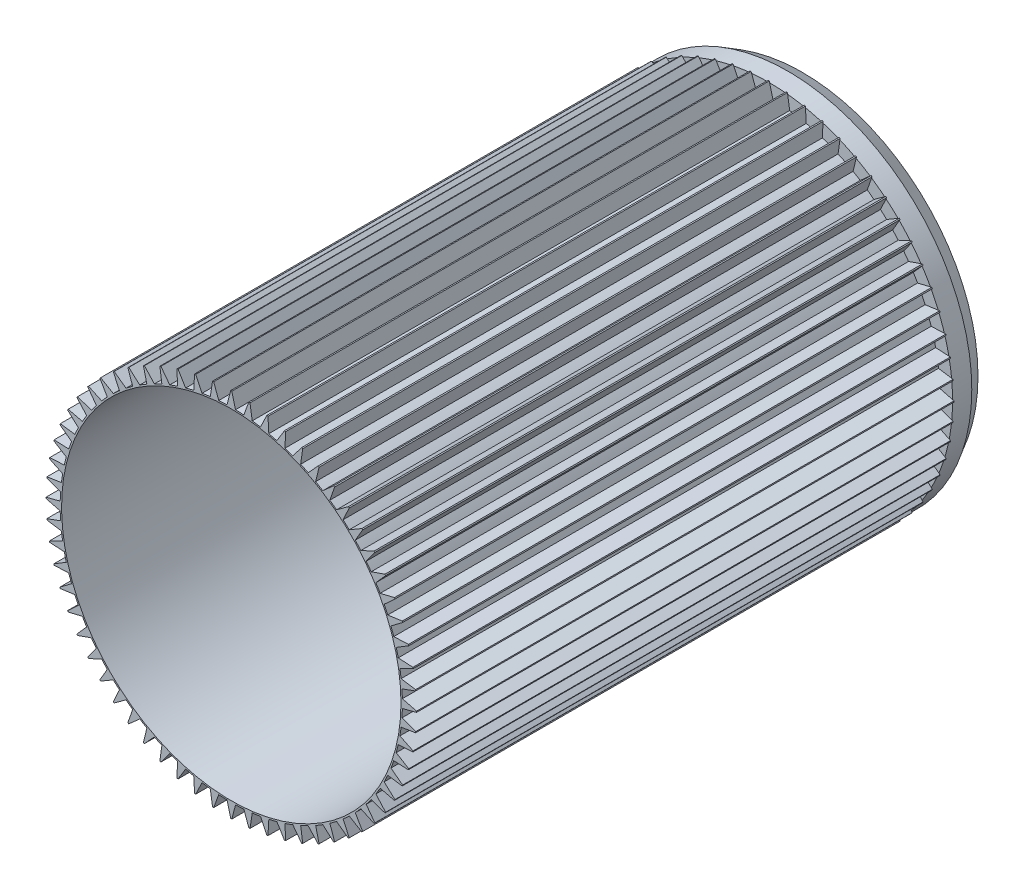
from build123d import *
from build123d.topology import SkipClean

# Parameters (mm, degrees)
BOSS_EXTRUDE1_START = 5
RING_1MM_R          = 65
RING_1MM_R_2        = 60
BOSS_EXTRUDE1_DEPTH = 5
CUT_EXTRUDE2_DEPTH  = 240
CIRPATTERN1_COUNT   = 6
CHAMFER1_SIZE       = 3
CHAMFER1_SIZE2      = 5.196152423
BOSS_EXTRUDE2_START = 190
SKETCH2_R           = 60.5
SKETCH2_R_2         = 60
BOSS_EXTRUDE2_DEPTH = 190
BOSS_EXTRUDE3_DEPTH = 190
CIRPATTERN2_COUNT   = 64


with BuildPart() as part:
    # Sketch1 → Revolve1 (revolve)
    with BuildSketch(Plane(origin=(0, 0, 0), x_dir=(-1, 0, 0), z_dir=(0, 1, 0)), mode=Mode.PRIVATE) as revolve1_sk:
        Polygon((65, 0), (65, 2), (18, 2), (18, -5), (65, -5), align=None)
    revolve(revolve1_sk.sketch.rotate(Axis((0, 0, 20), (0, 0, -1)), 180), axis=Axis((0, 0, 20), (0, 0, -1)))

    # ring-1mm → Boss-Extrude1 (add)
    with BuildSketch(Plane.XY.offset(2).offset(BOSS_EXTRUDE1_START)):
        Circle(RING_1MM_R)
        Circle(RING_1MM_R_2, mode=Mode.SUBTRACT)
    extrude(amount=-BOSS_EXTRUDE1_DEPTH)

    # Sketch3-base-openings → Cut-Extrude2 (cut)
    with SkipClean():  # the faces are left unmerged after this step: merging them gives an invalid solid
        with BuildSketch(Plane.XY.offset(2)):
            with BuildLine():
                Line((24.359616846, 8.86617545), (54.469759174, 19.825371007))
                ThreePointArc((54.469759174, 19.825371007), (56.030166948, 19.743756615), (57.055654614, 18.564812861))
                ThreePointArc((57.055654614, 18.564812861), (60, 0), (57.055654614, -18.564812861))
                ThreePointArc((57.055654614, -18.564812861), (56.030166948, -19.743756615), (54.469759174, -19.825371007))
                Line((54.469759174, -19.825371007), (24.359616846, -8.86617545))
                ThreePointArc((24.359616846, -8.86617545), (23.264917942, -7.90116808), (23.117221969, -6.449344808))
                ThreePointArc((23.117221969, -6.449344808), (24, 0), (23.117221969, 6.449344808))
                ThreePointArc((23.117221969, 6.449344808), (23.264917942, 7.90116808), (24.359616846, 8.86617545))
            make_face()
        cut_extrude2 = extrude(amount=-CUT_EXTRUDE2_DEPTH, mode=Mode.SUBTRACT)

    # CirPattern1: Cut-Extrude2 ×6 about axis
    cirpattern1_axis = Axis((0, 0, 0), (0, 0, 1))
    for i in range(1, CIRPATTERN1_COUNT):
        add(cut_extrude2.rotate(cirpattern1_axis, i * 360 / CIRPATTERN1_COUNT), mode=Mode.SUBTRACT)

    # Chamfer1
    chamfer1_edges = [part.edges().sort_by_distance(p)[0] for p in [
        (-65, 0, -5),
    ]]
    chamfer1_side = [part.faces().sort_by_distance(p)[0] for p in [
        (-63.161522369, 0, -5),
    ]]
    chamfer(chamfer1_edges, length=CHAMFER1_SIZE, length2=CHAMFER1_SIZE2, reference=chamfer1_side[0])

    # Sketch2 → Boss-Extrude2 (add)
    with SkipClean():  # the faces are left unmerged after this step: merging them gives an invalid solid
        with BuildSketch(Plane.XY.offset(7).offset(BOSS_EXTRUDE2_START)):
            Circle(SKETCH2_R)
            with Locations(Location((0, 0, 0), (0, 0, 161.976108286))):
                Circle(SKETCH2_R_2, mode=Mode.SUBTRACT)
        extrude(amount=-BOSS_EXTRUDE2_DEPTH)

    # Sketch3 → Boss-Extrude3 (add)
    with SkipClean():  # the faces are left unmerged after this step: merging them gives an invalid solid
        with BuildSketch(Plane.XY.offset(7)):
            Polygon((65.5, -0.2), (65.5, 0.2), (60.4814021, 1.5), (60.5, 0), (60.4814021, -1.5), align=None)
        boss_extrude3 = extrude(amount=BOSS_EXTRUDE3_DEPTH)

    # CirPattern2: Boss-Extrude3 ×64 about axis
    with SkipClean():  # the faces are left unmerged after this step: merging them gives an invalid solid
        cirpattern2_axis = Axis((0, 0, 0), (0, 0, 1))
        for i in range(1, CIRPATTERN2_COUNT):
            add(boss_extrude3.rotate(cirpattern2_axis, i * 360 / CIRPATTERN2_COUNT))


solid = part.part
